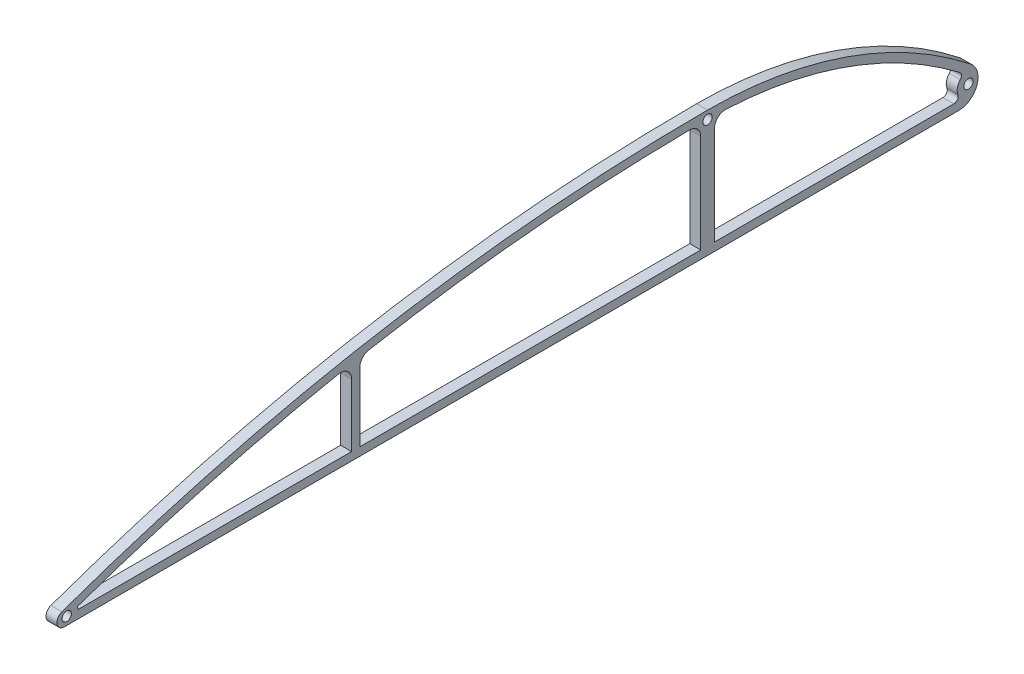
from build123d import *

# Parameters (mm, degrees)
BOSS_EXTRU_1_DEPTH      = 2
ESQUISSE4_R             = 0.85
ENL_V_MAT_EXTRU_2_DEPTH = 176.894862906
ENL_V_MAT_EXTRU_3_DEPTH = 4
CONG_2_R                = 1.35
CONG_3_R                = 2
CONG_4_R                = 0.8


with BuildPart() as part:
    # Esquisse2 → Boss.-Extru.1 (new body)
    with BuildSketch(Plane(origin=(0, 0, 0), x_dir=(0, 0, -1), z_dir=(1, 0, 0))):
        with BuildLine():
            Line((0, 0), (170.873171093, 0))
            ThreePointArc((170.873171093, 0), (174.177922559, 2.347343181), (173.049882129, 6.240789861))
            ThreePointArc((173.049882129, 6.240789861), (150.444362328, 18.689979585), (125, 23))
            ThreePointArc((125, 23), (61.450806457, 17.202138822), (0, 0))
        make_face()
    extrude(amount=BOSS_EXTRU_1_DEPTH)

    # Esquisse4 → Enlèv. mat.-Extru.2 (cut, through all)
    with BuildSketch(Plane(origin=(2, 0, 0), x_dir=(0, 0, -1), z_dir=(1, 0, 0))):
        with Locations((125, 21.5)):
            Circle(ESQUISSE4_R)
        with Locations((172.618958832, 3.328337296)):
            Circle(ESQUISSE4_R)
        with Locations((8, 1.468258741)):
            Circle(ESQUISSE4_R)
    extrude(amount=-ENL_V_MAT_EXTRU_2_DEPTH, mode=Mode.SUBTRACT)

    # Esquisse9 → Enlèv. mat.-Extru.3 (cut)
    with BuildSketch(Plane(origin=(0, 0, 0), x_dir=(0, 0, -1), z_dir=(1, 0, 0))):
        with BuildLine():
            Line((126.249998003, 1.5), (171.691768058, 1.5))
            ThreePointArc((171.691768058, 1.5), (170.572115715, 3.442061778), (171.900017887, 5.248135181))
            ThreePointArc((171.900017887, 5.248135181), (150.409026569, 17.120603469), (126.249998003, 21.497765776))
            Line((126.249998003, 21.497765776), (126.249998003, 1.5))
        make_face()
        with BuildLine():
            Line((10.049754252, 1.5), (60, 1.5))
            Line((60, 1.5), (60, 15.405547145))
            ThreePointArc((60, 15.405547145), (34.736840088, 9.649128542), (9.969292229, 2.037809542))
            ThreePointArc((9.969292229, 2.037809542), (10.027435185, 1.771584588), (10.049754252, 1.5))
        make_face()
        with BuildLine():
            Line((61.5, 1.5), (123.750001997, 1.5))
            Line((123.750001997, 1.5), (123.750001997, 21.497765776))
            ThreePointArc((123.750001997, 21.497765776), (92.494848054, 19.985907384), (61.5, 15.685935533))
            Line((61.5, 15.685935533), (61.5, 1.5))
        make_face()
    extrude(amount=ENL_V_MAT_EXTRU_3_DEPTH, mode=Mode.SUBTRACT)

    # Congé2
    cong_2_edges = [part.edges().sort_by_distance(p)[0] for p in [
        (1, 0, 0),
    ]]
    fillet(cong_2_edges, radius=CONG_2_R)

    # Congé3
    cong_3_edges = [part.edges().sort_by_distance(p)[0] for p in [
        (1, 21.497765776, -126.249998003),
        (1, 21.497765776, -123.750001997),
        (1, 15.405547145, -60),
        (1, 15.685935533, -61.5),
    ]]
    fillet(cong_3_edges, radius=CONG_3_R)

    # Congé4
    cong_4_edges = [part.edges().sort_by_distance(p)[0] for p in [
        (1, 1.5, -171.691768058),
        (1, 5.248135181, -171.900017887),
    ]]
    fillet(cong_4_edges, radius=CONG_4_R)


solid = part.part
